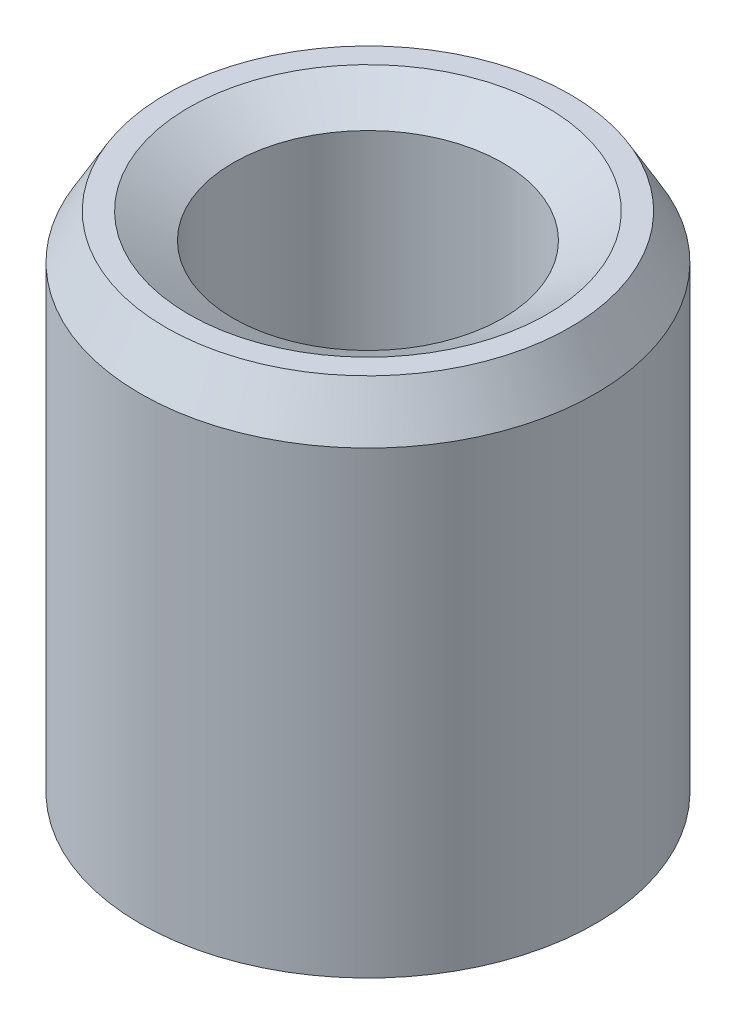
from build123d import *
from OCP.BRepFilletAPI import BRepFilletAPI_MakeChamfer

# Parameters (mm, degrees)
SKETCH1_R           = 17.5
BOSS_EXTRUDE1_DEPTH = 40.665113314
SKETCH2_R           = 10.356623259
CUT_EXTRUDE1_DEPTH  = 48.604111596
CHAMFER1_SIZE       = 3.415369487
CHAMFER1_SIZE2      = 1.971864493


with BuildPart() as part:
    # Sketch1 → Boss-Extrude1 (new body)
    with BuildSketch(Plane(origin=(0, 0, 0), x_dir=(1, 0, 0), z_dir=(0, 1, 0))):
        Circle(SKETCH1_R)
    extrude(amount=BOSS_EXTRUDE1_DEPTH)

    # Sketch2 → Cut-Extrude1 (cut, through all)
    with BuildSketch(Plane(origin=(0, 0, 0), x_dir=(1, 0, 0), z_dir=(0, 1, 0))):
        Circle(SKETCH2_R)
    extrude(amount=CUT_EXTRUDE1_DEPTH, mode=Mode.SUBTRACT)

    # Chamfer1: one chamfer whose edges measure the first distance from different faces: ONE call of the kernel's chamfer builder (chamfer() names one face for all edges)
    chamfer1_edges_1 = [part.edges().sort_by_distance(p)[0] for p in [
        (-10.356623259, 40.665113314, 0),
    ]]
    chamfer1_side_1 = [part.faces().sort_by_distance(p)[0] for p in [
        (-17.005025253, 40.665113314, 0),
    ]]
    chamfer1_edges_2 = [part.edges().sort_by_distance(p)[0] for p in [
        (-10.356623259, 0, 0),
    ]]
    chamfer1_side_2 = [part.faces().sort_by_distance(p)[0] for p in [
        (-10.356623259, 20.332556657, 0),
    ]]
    chamfer1_edges_3 = [part.edges().sort_by_distance(p)[0] for p in [
        (-17.5, 0, 0),
    ]]
    chamfer1_side_3 = [part.faces().sort_by_distance(p)[0] for p in [
        (-17.005025253, 0, 0),
    ]]
    chamfer1_edges_4 = [part.edges().sort_by_distance(p)[0] for p in [
        (-17.5, 40.665113314, 0),
    ]]
    chamfer1_side_4 = [part.faces().sort_by_distance(p)[0] for p in [
        (-17.5, 20.332556657, 0),
    ]]
    chamfer1 = BRepFilletAPI_MakeChamfer(part.part.solid().wrapped)
    for e in chamfer1_edges_1:
        chamfer1.Add(CHAMFER1_SIZE, CHAMFER1_SIZE2, e.wrapped, chamfer1_side_1[0].wrapped)  # the first distance lies on this face
    for e in chamfer1_edges_2:
        chamfer1.Add(CHAMFER1_SIZE, CHAMFER1_SIZE2, e.wrapped, chamfer1_side_2[0].wrapped)  # the first distance lies on this face
    for e in chamfer1_edges_3:
        chamfer1.Add(CHAMFER1_SIZE, CHAMFER1_SIZE2, e.wrapped, chamfer1_side_3[0].wrapped)  # the first distance lies on this face
    for e in chamfer1_edges_4:
        chamfer1.Add(CHAMFER1_SIZE, CHAMFER1_SIZE2, e.wrapped, chamfer1_side_4[0].wrapped)  # the first distance lies on this face
    add(Compound.cast(chamfer1.Shape()), mode=Mode.REPLACE)


solid = part.part
